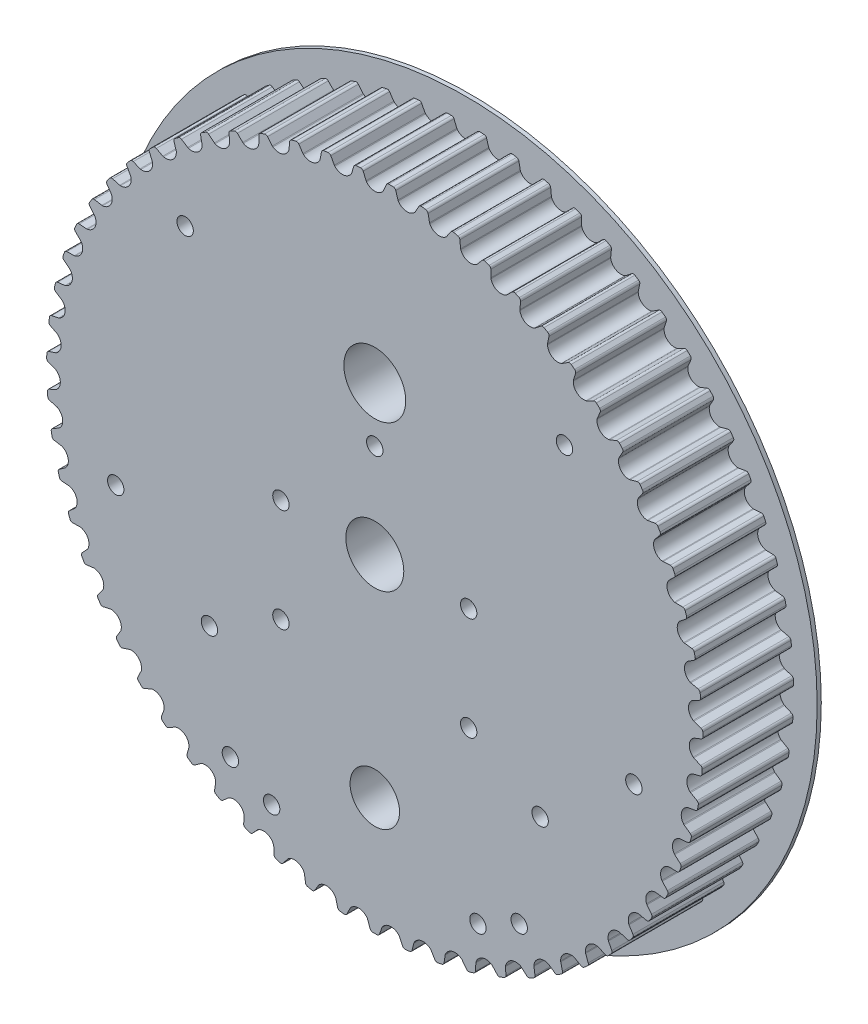
from build123d import *

# Parameters (mm, degrees)
BOSS_EXTRUDE1_DEPTH = 22
SKETCH2_R           = 85.214091318
BOSS_EXTRUDE2_DEPTH = 1
SKETCH3_R           = 7.025
SKETCH3_R_2         = 6
SKETCH3_R_3         = 7.5
CUT_EXTRUDE1_DEPTH  = 123.686114611
SKETCH4_R           = 1.985
CUT_EXTRUDE2_DEPTH  = 18


with BuildPart() as part:
    # Sketch1 → Boss-Extrude1 (new body)
    with BuildSketch(Plane.XY):
        with BuildLine():
            ThreePointArc((-2.00858237, 77.225966305), (-2.06415437, 77.308346172), (-2.108533634, 77.397257198))
            Line((-2.108533634, 77.397257198), (-2.806365183, 79.058376339))
            ThreePointArc((-2.806365183, 79.058376339), (-3.057533909, 79.355500397), (-3.433430091, 79.455852257))
            ThreePointArc((-3.433430091, 79.455852257), (-3.69885733, 79.443938437), (-3.964243287, 79.431137945))
            ThreePointArc((-3.964243287, 79.431137945), (-4.229584998, 79.417450921), (-4.494879503, 79.402877519))
            ThreePointArc((-4.494879503, 79.402877519), (-4.858915954, 79.265597157), (-5.079252563, 78.944941245))
            Line((-5.079252563, 78.944941245), (-5.608222375, 77.222594994))
            ThreePointArc((-5.608222375, 77.222594994), (-5.643528429, 77.129707039), (-5.690621893, 77.042203352))
            ThreePointArc((-5.690621893, 77.042203352), (-7.591122322, 75.861842835), (-9.687824439, 76.642222909))
            ThreePointArc((-9.687824439, 76.642222909), (-9.751322675, 76.718660228), (-9.804334089, 76.802710687))
            Line((-9.804334089, 76.802710687), (-10.664092012, 78.386093769))
            ThreePointArc((-10.664092012, 78.386093769), (-10.943596627, 78.656733022), (-11.327616714, 78.719159038))
            ThreePointArc((-11.327616714, 78.719159038), (-11.590538753, 78.680876402), (-11.853331429, 78.64171561))
            ThreePointArc((-11.853331429, 78.64171561), (-12.11599181, 78.601677097), (-12.378516965, 78.560761311))
            ThreePointArc((-12.378516965, 78.560761311), (-12.727075727, 78.3879168), (-12.914390416, 78.046915859))
            Line((-12.914390416, 78.046915859), (-13.26924135, 76.280459947))
            ThreePointArc((-13.26924135, 76.280459947), (-13.295123307, 76.184518226), (-13.333270199, 76.092760369))
            ThreePointArc((-13.333270199, 76.092760369), (-15.10680066, 74.729036594), (-17.270784557, 75.29677467))
            ThreePointArc((-17.270784557, 75.29677467), (-17.341577955, 75.366509771), (-17.402694666, 75.444864333))
            Line((-17.402694666, 75.444864333), (-18.415834303, 76.934774984))
            ThreePointArc((-18.415834303, 76.934774984), (-18.720896964, 77.176239697), (-19.109224393, 77.20011945))
            ThreePointArc((-19.109224393, 77.20011945), (-19.367028194, 77.135848468), (-19.624615838, 77.070716574))
            ThreePointArc((-19.624615838, 77.070716574), (-19.881984453, 77.004724493), (-20.139131164, 76.937872962))
            ThreePointArc((-20.139131164, 76.937872962), (-20.468748104, 76.73118211), (-20.621179254, 76.373225158))
            Line((-20.621179254, 76.373225158), (-20.798384643, 74.58021542))
            ThreePointArc((-20.798384643, 74.58021542), (-20.814585277, 74.482173443), (-20.843406476, 74.387073348))
            ThreePointArc((-20.843406476, 74.387073348), (-22.472340826, 72.853539614), (-24.682099858, 73.202993255))
            ThreePointArc((-24.682099858, 73.202993255), (-24.759484842, 73.265333081), (-24.828099445, 73.337213021))
            Line((-24.828099445, 73.337213021), (-25.984551758, 74.71884384))
            ThreePointArc((-25.984551758, 74.71884384), (-26.312140616, 74.928734228), (-26.700916015, 74.913830392))
            ThreePointArc((-26.700916015, 74.913830392), (-26.951039407, 74.824209818), (-27.200861999, 74.733754131))
            ThreePointArc((-27.200861999, 74.733754131), (-27.450381001, 74.642464341), (-27.69959363, 74.550341466))
            ThreePointArc((-27.69959363, 74.550341466), (-28.006992866, 74.311858458), (-28.123025549, 73.940503033))
            Line((-28.123025549, 73.940503033), (-28.120824246, 72.138759204))
            ThreePointArc((-28.120824246, 72.138759204), (-28.127182546, 72.039591358), (-28.146391615, 71.942094172))
            ThreePointArc((-28.146391615, 71.942094172), (-29.614540772, 70.253991426), (-31.848113362, 70.381687605))
            ThreePointArc((-31.848113362, 70.381687605), (-31.931320845, 70.436012594), (-32.006751418, 70.500703539))
            Line((-32.006751418, 70.500703539), (-33.295023065, 71.760323257))
            ThreePointArc((-33.295023065, 71.760323257), (-33.641882394, 71.936553336), (-34.027241938, 71.88301403))
            ThreePointArc((-34.027241938, 71.88301403), (-34.267199083, 71.768934554), (-34.506773772, 71.654054064))
            ThreePointArc((-34.506773772, 71.654054064), (-34.745963331, 71.538373844), (-34.98476509, 71.421895183))
            ThreePointArc((-34.98476509, 71.421895183), (-35.26689155, 71.153990171), (-35.345372581, 70.77292697))
            Line((-35.345372581, 70.77292697), (-35.163786463, 68.98035559))
            ThreePointArc((-35.163786463, 68.98035559), (-35.160239239, 68.881047449), (-35.169645269, 68.782122143))
            ThreePointArc((-35.169645269, 68.782122143), (-36.462418108, 66.956227509), (-38.697606007, 66.860897123))
            ThreePointArc((-38.697606007, 66.860897123), (-38.785809036, 66.90666737), (-38.867305915, 66.963526391))
            Line((-38.867305915, 66.963526391), (-40.274593474, 68.088616342))
            ThreePointArc((-40.274593474, 68.088616342), (-40.637276031, 68.229434657), (-41.015389843, 68.137791981))
            ThreePointArc((-41.015389843, 68.137791981), (-41.242795939, 68.000387375), (-41.469741725, 67.862223816))
            ThreePointArc((-41.469741725, 67.862223816), (-41.696224666, 67.723302847), (-41.922242237, 67.583626019))
            ThreePointArc((-41.922242237, 67.583626019), (-42.176292022, 67.288961563), (-42.21644142, 66.901977763))
            Line((-42.21644142, 66.901977763), (-41.857275173, 65.136394212))
            ThreePointArc((-41.857275173, 65.136394212), (-41.843857678, 65.037932745), (-41.843367187, 64.938562482))
            ThreePointArc((-41.843367187, 64.938562482), (-42.947915551, 62.993022521), (-45.162504458, 62.675613008))
            ThreePointArc((-45.162504458, 62.675613008), (-45.254826431, 62.712373626), (-45.341579664, 62.760835633))
            Line((-45.341579664, 62.760835633), (-46.853896879, 63.740214167))
            ThreePointArc((-46.853896879, 63.740214167), (-47.228798161, 63.844221204), (-47.595908377, 63.715385943))
            ThreePointArc((-47.595908377, 63.715385943), (-47.80850336, 63.556021795), (-48.020564753, 63.395948299))
            ThreePointArc((-48.020564753, 63.395948299), (-48.232090189, 63.235167241), (-48.443077306, 63.073680416))
            ThreePointArc((-48.443077306, 63.073680416), (-48.666525555, 62.755185023), (-48.667944298, 62.366126644))
            Line((-48.667944298, 62.366126644), (-48.134767477, 60.645078084))
            ThreePointArc((-48.134767477, 60.645078084), (-48.11161306, 60.548441845), (-48.101230924, 60.449614213))
            ThreePointArc((-48.101230924, 60.449614213), (-49.006577314, 58.403764575), (-51.17855765, 57.867430492))
            ThreePointArc((-51.17855765, 57.867430492), (-51.274081029, 57.894816138), (-51.365228424, 57.934399494))
            Line((-51.365228424, 57.934399494), (-52.967545206, 58.758333108))
            ThreePointArc((-52.967545206, 58.758333108), (-53.350939277, 58.824495197), (-53.70339739, 58.659747773))
            ThreePointArc((-53.70339739, 58.659747773), (-53.899068396, 58.480007918), (-54.094137835, 58.299615367))
            ThreePointArc((-54.094137835, 58.299615367), (-54.288603529, 58.118572134), (-54.482463308, 57.936880239))
            ThreePointArc((-54.482463308, 57.936880239), (-54.673089293, 57.597719261), (-54.635763281, 57.210452939))
            Line((-54.635763281, 57.210452939), (-53.933874836, 55.551043924))
            ThreePointArc((-53.933874836, 55.551043924), (-53.901213616, 55.457193328), (-53.881043017, 55.359890519))
            ThreePointArc((-53.881043017, 55.359890519), (-54.578189694, 53.234063777), (-56.685975343, 52.484135454))
            ThreePointArc((-56.685975343, 52.484135454), (-56.783750775, 52.501873957), (-56.878386467, 52.532185265))
            Line((-56.878386467, 52.532185265), (-58.554778273, 53.192485336))
            ThreePointArc((-58.554778273, 53.192485336), (-58.942854789, 53.220144929), (-59.277157912, 53.021122677))
            ThreePointArc((-59.277157912, 53.021122677), (-59.453960275, 52.822793448), (-59.630099072, 52.623874664))
            ThreePointArc((-59.630099072, 52.623874664), (-59.805572338, 52.424368545), (-59.980378113, 52.224277318))
            ThreePointArc((-59.980378113, 52.224277318), (-60.136287306, 51.867821488), (-60.060587502, 51.48619605))
            Line((-60.060587502, 51.48619605), (-59.196963116, 49.904918532))
            ThreePointArc((-59.196963116, 49.904918532), (-59.155119696, 49.814786308), (-59.125361097, 49.719975362))
            ThreePointArc((-59.125361097, 49.719975362), (-59.607379505, 47.535298937), (-61.630022345, 46.579229498))
            ThreePointArc((-61.630022345, 46.579229498), (-61.729078094, 46.587144566), (-61.826261552, 46.607882577))
            Line((-61.826261552, 46.607882577), (-63.560067646, 47.097986747))
            ThreePointArc((-63.560067646, 47.097986747), (-63.948969729, 47.08686895), (-64.261795408, 46.855549842))
            ThreePointArc((-64.261795408, 46.855549842), (-64.417971986, 46.640602325), (-64.573429595, 46.425134253))
            ThreePointArc((-64.573429595, 46.425134253), (-64.7281665, 46.209148029), (-64.882180973, 45.992646066))
            ThreePointArc((-64.882180973, 45.992646066), (-65.001823879, 45.622438002), (-64.888502621, 45.250246213))
            Line((-64.888502621, 45.250246213), (-63.871725381, 43.762815639))
            ThreePointArc((-63.871725381, 43.762815639), (-63.821115619, 43.677297561), (-63.782064776, 43.585920752))
            ThreePointArc((-63.782064776, 43.585920752), (-64.044164399, 41.36410694), (-65.961562497, 40.211398233))
            ThreePointArc((-65.961562497, 40.211398233), (-66.060914102, 40.209411201), (-66.159679472, 40.220369813))
            Line((-66.159679472, 40.220369813), (-67.933668512, 40.535407206))
            ThreePointArc((-67.933668512, 40.535407206), (-68.319531077, 40.485622513), (-68.60777031, 40.224305502))
            ThreePointArc((-68.60777031, 40.224305502), (-68.74176895, 39.994875943), (-68.875000363, 39.765))
            ThreePointArc((-68.875000363, 39.765), (-69.007463062, 39.53468024), (-69.139155569, 39.303919234))
            ThreePointArc((-69.139155569, 39.303919234), (-69.221343123, 38.923638231), (-69.071526649, 38.5645791))
            Line((-69.071526649, 38.5645791), (-67.911701744, 37.185778223))
            ThreePointArc((-67.911701744, 37.185778223), (-67.852828622, 37.105724209), (-67.80487364, 37.018689679))
            ThreePointArc((-67.80487364, 37.018689679), (-67.844449614, 34.781819864), (-69.637547006, 33.443928026))
            ThreePointArc((-69.637547006, 33.443928026), (-69.736207066, 33.432058643), (-69.835572775, 33.433128944))
            Line((-69.835572775, 33.433128944), (-71.632114059, 33.569968577))
            ThreePointArc((-71.632114059, 33.569968577), (-72.011102232, 33.48201177), (-72.271890367, 33.193293943))
            ThreePointArc((-72.271890367, 33.193293943), (-72.382379331, 32.951662514), (-72.492060434, 32.709663312))
            ThreePointArc((-72.492060434, 32.709663312), (-72.600932454, 32.467299037), (-72.708994175, 32.224572395))
            ThreePointArc((-72.708994175, 32.224572395), (-72.75290956, 31.837997856), (-72.568086813, 31.495639874))
            Line((-72.568086813, 31.495639874), (-71.276741104, 30.239171836))
            ThreePointArc((-71.276741104, 30.239171836), (-71.210189731, 30.165377498), (-71.153807206, 30.083550238))
            ThreePointArc((-71.153807206, 30.083550238), (-70.970466208, 27.853855436), (-72.621442287, 26.344077037))
            ThreePointArc((-72.621442287, 26.344077037), (-72.718430274, 26.322443267), (-72.81740878, 26.313614619))
            Line((-72.81740878, 26.313614619), (-74.618647475, 26.270896518))
            ThreePointArc((-74.618647475, 26.270896518), (-74.986994701, 26.145641752), (-75.217739908, 25.832392516))
            ThreePointArc((-75.217739908, 25.832392516), (-75.303621106, 25.58096066), (-75.388661841, 25.329243295))
            ThreePointArc((-75.388661841, 25.329243295), (-75.472861162, 25.07724323), (-75.556218131, 24.824963278))
            ThreePointArc((-75.556218131, 24.824963278), (-75.561424896, 24.435937154), (-75.343432728, 24.113682829))
            Line((-75.343432728, 24.113682829), (-73.933400189, 22.992034974))
            ThreePointArc((-73.933400189, 22.992034974), (-73.859831981, 22.925233714), (-73.79558227, 22.849426958))
            ThreePointArc((-73.79558227, 22.849426958), (-73.391146424, 20.64906688), (-74.883593049, 18.982406775))
            ThreePointArc((-74.883593049, 18.982406775), (-74.977945052, 18.951223623), (-75.075552662, 18.93258377))
            Line((-75.075552662, 18.93258377), (-76.863587248, 18.710732487))
            ThreePointArc((-76.863587248, 18.710732487), (-77.217632726, 18.5494246), (-77.416041757, 18.214757166))
            ThreePointArc((-77.416041757, 18.214757166), (-77.476461664, 17.956023725), (-77.536016856, 17.697089878))
            ThreePointArc((-77.536016856, 17.697089878), (-77.594706668, 17.437958512), (-77.652530446, 17.178632522))
            ThreePointArc((-77.652530446, 17.178632522), (-77.618976844, 16.791021131), (-77.369981759, 16.492073171))
            Line((-77.369981759, 16.492073171), (-75.855275927, 15.516392939))
            ThreePointArc((-75.855275927, 15.516392939), (-75.775422038, 15.457248658), (-75.703943683, 15.388215808))
            ThreePointArc((-75.703943683, 15.388215808), (-75.082432455, 13.239058619), (-76.401517019, 11.432080827))
            ThreePointArc((-76.401517019, 11.432080827), (-76.492295327, 11.391658204), (-76.587561973, 11.363392398))
            Line((-76.587561973, 11.363392398), (-78.344622159, 10.96461279))
            ThreePointArc((-78.344622159, 10.96461279), (-78.680847227, 10.768854933), (-78.844948203, 10.416095376))
            ThreePointArc((-78.844948203, 10.416095376), (-78.879306338, 10.15263176), (-78.912784101, 9.889054831))
            ThreePointArc((-78.912784101, 9.889054831), (-78.945381118, 9.625367529), (-78.977097026, 9.361572799))
            ThreePointArc((-78.977097026, 9.361572799), (-78.905116528, 8.979228396), (-78.627593151, 8.70655788))
            Line((-78.627593151, 8.70655788), (-77.023267853, 7.88654202))
            ThreePointArc((-77.023267853, 7.88654202), (-76.937921907, 7.83564252), (-76.859925292, 7.774069656))
            ThreePointArc((-76.859925292, 7.774069656), (-76.02751554, 5.697474646), (-77.160128389, 3.768137723))
            ThreePointArc((-77.160128389, 3.768137723), (-77.246430806, 3.718877369), (-77.338409685, 3.681266527))
            Line((-77.338409685, 3.681266527), (-79.047033017, 3.109521846))
            ThreePointArc((-79.047033017, 3.109521846), (-79.362096118, 2.881259547), (-79.49025813, 2.513913751))
            ThreePointArc((-79.49025813, 2.513913751), (-79.498213027, 2.248338379), (-79.505280645, 1.982737914))
            ThreePointArc((-79.505280645, 1.982737914), (-79.511460903, 1.717115319), (-79.516753735, 1.45147356))
            ThreePointArc((-79.516753735, 1.45147356), (-79.407061715, 1.078196055), (-79.103768198, 0.834512905))
            Line((-79.103768198, 0.834512905), (-77.425767939, 0.178311104))
            ThreePointArc((-77.425767939, 0.178311104), (-77.335778143, 0.136162246), (-77.252038432, 0.082661306))
            ThreePointArc((-77.252038432, 0.082661306), (-76.217003018, -1.90073339), (-77.151887737, -3.933254827))
            ThreePointArc((-77.151887737, -3.933254827), (-77.23285655, -3.990863341), (-77.320633535, -4.037445425))
            Line((-77.320633535, -4.037445425), (-78.963838947, -4.776472924))
            ThreePointArc((-78.963838947, -4.776472924), (-79.254608844, -5.034971091), (-79.34555816, -5.413252278))
            ThreePointArc((-79.34555816, -5.413252278), (-79.32703076, -5.678299998), (-79.30761799, -5.943284343))
            ThreePointArc((-79.30761799, -5.943284343), (-79.287320068, -6.208202354), (-79.26613722, -6.473051076))
            ThreePointArc((-79.26613722, -6.473051076), (-79.119823847, -6.833551883), (-78.793774457, -7.045825835))
            Line((-78.793774457, -7.045825835), (-77.058775958, -7.531691949))
            ThreePointArc((-77.058775958, -7.531691949), (-76.96503667, -7.564671269), (-76.876386108, -7.609568568))
            ThreePointArc((-76.876386108, -7.609568568), (-75.649011679, -9.480051083), (-76.376876962, -11.595556923))
            ThreePointArc((-76.376876962, -11.595556923), (-76.451707468, -11.660941057), (-76.534410191, -11.71603143))
            Line((-76.534410191, -11.71603143), (-78.09586677, -12.61499696))
            ThreePointArc((-78.09586677, -12.61499696), (-78.35945366, -12.901161924), (-78.412286386, -13.286618975))
            ThreePointArc((-78.412286386, -13.286618975), (-78.367460821, -13.54850488), (-78.321760597, -13.81023957))
            ThreePointArc((-78.321760597, -13.81023957), (-78.275186224, -14.071820124), (-78.227738222, -14.333243622))
            ThreePointArc((-78.227738222, -14.333243622), (-78.046257623, -14.677384912), (-77.700692786, -14.856139991))
            Line((-77.700692786, -14.856139991), (-75.925939242, -15.166841663))
            ThreePointArc((-75.925939242, -15.166841663), (-75.829382086, -15.190323683), (-75.736701721, -15.226171131))
            ThreePointArc((-75.736701721, -15.226171131), (-74.329186474, -16.965151769), (-74.842798471, -19.142617164))
            ThreePointArc((-74.842798471, -19.142617164), (-74.910746969, -19.215127103), (-74.987553495, -19.278178251))
            Line((-74.987553495, -19.278178251), (-76.451742783, -20.328147489))
            ThreePointArc((-76.451742783, -20.328147489), (-76.685527021, -20.639135214), (-76.699718081, -21.027937283))
            ThreePointArc((-76.699718081, -21.027937283), (-76.629039849, -21.284058633), (-76.55750636, -21.539942431))
            ThreePointArc((-76.55750636, -21.539942431), (-76.485118413, -21.795585823), (-76.411876815, -22.050985954))
            ThreePointArc((-76.411876815, -22.050985954), (-76.197032628, -22.375347496), (-75.835386721, -22.518807154))
            Line((-75.835386721, -22.518807154), (-74.03851643, -22.651256491))
            ThreePointArc((-74.03851643, -22.651256491), (-73.940101034, -22.665007835), (-73.844311965, -22.691449165))
            ThreePointArc((-73.844311965, -22.691449165), (-72.270644421, -24.281645156), (-72.564898624, -26.499429476))
            ThreePointArc((-72.564898624, -26.499429476), (-72.625289812, -26.578344583), (-72.695436802, -26.648729876))
            Line((-72.695436802, -26.648729876), (-74.047807028, -27.839267755))
            ThreePointArc((-74.047807028, -27.839267755), (-74.249465162, -28.171987505), (-74.224873518, -28.560270502))
            ThreePointArc((-74.224873518, -28.560270502), (-74.129045051, -28.808081849), (-74.03238923, -29.055571668))
            ThreePointArc((-74.03238923, -29.055571668), (-73.934907133, -29.302737198), (-73.836599848, -29.54957568))
            ThreePointArc((-73.836599848, -29.54957568), (-73.590527289, -29.850933824), (-73.216394513, -29.957672294))
            Line((-73.216394513, -29.957672294), (-71.415265579, -29.910552956))
            ThreePointArc((-71.415265579, -29.910552956), (-71.315970039, -29.914436957), (-71.218024262, -29.931209383))
            ThreePointArc((-71.218024262, -29.931209383), (-69.493844234, -31.356816644), (-69.565816213, -33.592878553))
            ThreePointArc((-69.565816213, -33.592878553), (-69.618049897, -33.677414533), (-69.680840198, -33.754434451))
            Line((-69.680840198, -33.754434451), (-70.9079509, -35.073708871))
            ThreePointArc((-70.9079509, -35.073708871), (-71.075478761, -35.424853928), (-71.012348816, -35.808758923))
            ThreePointArc((-71.012348816, -35.808758923), (-70.8923225, -36.045797405), (-70.771504955, -36.282433579))
            ThreePointArc((-70.771504955, -36.282433579), (-70.649897529, -36.518664806), (-70.527501579, -36.754488447))
            ThreePointArc((-70.527501579, -36.754488447), (-70.252646228, -37.02984816), (-69.869744883, -37.098804628))
            Line((-69.869744883, -37.098804628), (-68.082257733, -36.872584907))
            ThreePointArc((-68.082257733, -36.872584907), (-67.983068894, -36.866562964), (-67.883939837, -36.873499794))
            ThreePointArc((-67.883939837, -36.873499794), (-66.026383002, -38.12035), (-65.875357467, -40.35246651))
            ThreePointArc((-65.875357467, -40.35246651), (-65.918914524, -40.441783207), (-65.973724099, -40.524672291))
            Line((-65.973724099, -40.524672291), (-67.0633797, -41.95957171))
            ThreePointArc((-67.0633797, -41.95957171), (-67.195112319, -42.325652237), (-67.094071488, -42.701363809))
            ThreePointArc((-67.094071488, -42.701363809), (-66.951040198, -42.925273632), (-66.807261668, -43.148704365))
            ThreePointArc((-66.807261668, -43.148704365), (-66.662737502, -43.371653516), (-66.517469313, -43.594118596))
            ThreePointArc((-66.517469313, -43.594118596), (-66.216562807, -43.840743229), (-65.828698337, -43.871232375))
            Line((-65.828698337, -43.871232375), (-64.072617824, -43.468160543))
            ThreePointArc((-64.072617824, -43.468160543), (-63.974521468, -43.452292506), (-63.87519432, -43.449324799))
            ThreePointArc((-63.87519432, -43.449324799), (-61.902721912, -44.505026192), (-61.530199822, -46.711013526))
            ThreePointArc((-61.530199822, -46.711013526), (-61.564647364, -46.804223271), (-61.61093149, -46.892157731))
            Line((-61.61093149, -46.892157731), (-62.552302502, -48.428421475))
            ThreePointArc((-62.552302502, -48.428421475), (-62.646930663, -48.805799198), (-62.508983134, -49.169583358))
            ThreePointArc((-62.508983134, -49.169583358), (-62.34436838, -49.378139204), (-62.179057801, -49.586143942))
            ThreePointArc((-62.179057801, -49.586143942), (-62.013053241, -49.793595248), (-61.846356553, -50.000490808))
            ThreePointArc((-61.846356553, -50.000490808), (-61.522389436, -50.215929295), (-61.133416613, -50.207648104))
            Line((-61.133416613, -50.207648104), (-59.426195452, -49.631730072))
            ThreePointArc((-59.426195452, -49.631730072), (-59.330166505, -49.606173643), (-59.231628424, -49.593330893))
            ThreePointArc((-59.231628424, -49.593330893), (-57.163843761, -50.447391438), (-56.573527408, -52.605325504))
            ThreePointArc((-56.573527408, -52.605325504), (-56.598523079, -52.701501936), (-56.635821764, -52.793607841))
            Line((-56.635821764, -52.793607841), (-57.419552419, -54.41596783))
            ThreePointArc((-57.419552419, -54.41596783), (-57.476135664, -54.800892201), (-57.302652422, -55.149133496))
            ThreePointArc((-57.302652422, -55.149133496), (-57.118090219, -55.340262646), (-56.932890522, -55.530774142))
            ThreePointArc((-56.932890522, -55.530774142), (-56.747055396, -55.72066586), (-56.560586916, -55.90993568))
            ThreePointArc((-56.560586916, -55.90993568), (-56.216778918, -56.092046896), (-55.830563529, -56.045077669))
            Line((-55.830563529, -56.045077669), (-54.189168851, -55.302037168))
            ThreePointArc((-54.189168851, -55.302037168), (-54.096161693, -55.26704634), (-53.999391995, -55.244456184))
            ThreePointArc((-53.999391995, -55.244456184), (-51.856845649, -55.888387845), (-51.054601862, -57.976822123))
            ThreePointArc((-51.054601862, -57.976822123), (-51.069897244, -58.075009398), (-51.097839797, -58.170371358))
            Line((-51.097839797, -58.170371358), (-51.716141027, -59.862703849))
            ThreePointArc((-51.716141027, -59.862703849), (-51.734117007, -60.251349316), (-51.526822206, -60.580586769))
            ThreePointArc((-51.526822206, -60.580586769), (-51.324146817, -60.752389694), (-51.120898598, -60.923514561))
            ThreePointArc((-51.120898598, -60.923514561), (-50.91707982, -61.093959461), (-50.712692755, -61.263722491))
            ThreePointArc((-50.712692755, -61.263722491), (-50.352460794, -61.410696534), (-49.972841221, -61.325506073))
            Line((-49.972841221, -61.325506073), (-48.413585945, -60.422727774))
            ThreePointArc((-48.413585945, -60.422727774), (-48.324524922, -60.378650301), (-48.230485347, -60.34653725))
            ThreePointArc((-48.230485347, -60.34653725), (-46.034470906, -60.773940343), (-45.028272746, -62.772119037))
            ThreePointArc((-45.028272746, -62.772119037), (-45.033715825, -62.871341325), (-45.05202454, -62.96901159))
            Line((-45.05202454, -62.96901159), (-45.498751392, -64.714497422))
            ThreePointArc((-45.498751392, -64.714497422), (-45.477941452, -65.103001453), (-45.238895282, -65.409962954))
            ThreePointArc((-45.238895282, -65.409962954), (-45.020120985, -65.560732199), (-44.800844218, -65.710769721))
            ThreePointArc((-44.800844218, -65.710769721), (-44.581067429, -65.860073845), (-44.36079307, -66.008642905))
            ThreePointArc((-44.36079307, -66.008642905), (-43.987717294, -66.11901908), (-43.618466366, -65.996454046))
            Line((-43.618466366, -65.996454046), (-42.156847072, -64.942910166))
            ThreePointArc((-42.156847072, -64.942910166), (-42.072617311, -64.890184109), (-41.982242468, -64.848867317))
            ThreePointArc((-41.982242468, -64.848867317), (-39.75458491, -65.055494119), (-38.554432425, -66.94355843))
            ThreePointArc((-38.554432425, -66.94355843), (-38.549969107, -67.042829616), (-38.558462024, -67.141837494))
            Line((-38.558462024, -67.141837494), (-38.829174724, -68.923129246))
            ThreePointArc((-38.829174724, -68.923129246), (-38.769785684, -69.307630712), (-38.501363892, -69.589265541))
            ThreePointArc((-38.501363892, -69.589265541), (-38.268664964, -69.717502694), (-38.03553892, -69.84496173))
            ThreePointArc((-38.03553892, -69.84496173), (-37.801988361, -69.971641227), (-37.568015894, -70.09753977))
            ThreePointArc((-37.568015894, -70.09753977), (-37.185804097, -70.170221109), (-36.830591596, -70.011499609))
            Line((-36.830591596, -70.011499609), (-35.481134512, -68.817660739))
            ThreePointArc((-35.481134512, -68.817660739), (-35.402573128, -68.756810114), (-35.316761201, -68.706700205))
            ThreePointArc((-35.316761201, -68.706700205), (-33.079599989, -68.690497167), (-31.697420833, -70.449682663))
            ThreePointArc((-31.697420833, -70.449682663), (-31.683095476, -70.548016146), (-31.681688189, -70.647377653))
            Line((-31.681688189, -70.647377653), (-31.773696272, -72.446772047))
            ThreePointArc((-31.773696272, -72.446772047), (-31.676318367, -72.8234496), (-31.38118865, -73.076958742))
            ThreePointArc((-31.38118865, -73.076958742), (-31.136877758, -73.181389325), (-30.892219348, -73.28500313))
            ThreePointArc((-30.892219348, -73.28500313), (-30.647216149, -73.387799002), (-30.401870897, -73.489775792))
            ThreePointArc((-30.401870897, -73.489775792), (-30.014321672, -73.524039956), (-29.67667786, -73.330739435))
            Line((-29.67667786, -73.330739435), (-28.452794497, -72.008470482))
            ThreePointArc((-28.452794497, -72.008470482), (-28.380682267, -71.940100049), (-28.300286095, -71.88169504))
            ThreePointArc((-28.300286095, -71.88169504), (-26.075855141, -71.642823194), (-24.525386033, -73.2556463))
            ThreePointArc((-24.525386033, -73.2556463), (-24.501341009, -73.352064796), (-24.490047503, -73.450792433))
            Line((-24.490047503, -73.450792433), (-24.402436553, -75.250406279))
            ThreePointArc((-24.402436553, -75.250406279), (-24.268037567, -75.615516328), (-23.949133056, -75.838380296))
            ThreePointArc((-23.949133056, -75.838380296), (-23.695638272, -75.91796643), (-23.441879021, -75.996705244))
            ThreePointArc((-23.441879021, -75.996705244), (-23.187858135, -76.074595859), (-22.933578449, -76.151637405))
            ThreePointArc((-22.933578449, -76.151637405), (-22.544543434, -76.147143861), (-22.227823967, -75.921185426))
            Line((-22.227823967, -75.921185426), (-21.141677827, -74.483627694))
            ThreePointArc((-21.141677827, -74.483627694), (-21.076731436, -74.40841695), (-21.002550032, -74.342297294))
            ThreePointArc((-21.002550032, -74.342297294), (-18.81295673, -73.883130656), (-17.109606927, -75.333562412))
            ThreePointArc((-17.109606927, -75.333562412), (-17.076081206, -75.427107672), (-17.055013722, -75.524220239))
            Line((-17.055013722, -75.524220239), (-16.788654455, -77.306168165))
            ThreePointArc((-16.788654455, -77.306168165), (-16.618570107, -77.656082083), (-16.279060219, -77.846085954))
            ThreePointArc((-16.279060219, -77.846085954), (-16.018900887, -77.900036678), (-15.758562769, -77.953117959))
            ThreePointArc((-15.758562769, -77.953117959), (-15.498048769, -78.005329205), (-15.237361795, -78.056669834))
            ThreePointArc((-15.237361795, -78.056669834), (-14.850707394, -78.01346324), (-14.558059972, -77.757092568))
            Line((-14.558059972, -77.757092568), (-13.620445664, -76.218533151))
            ThreePointArc((-13.620445664, -76.218533151), (-13.563310579, -76.137229574), (-13.49608119, -76.064052399))
            ThreePointArc((-13.49608119, -76.064052399), (-11.363086703, -75.389154373), (-9.523784861, -76.662779735))
            ThreePointArc((-9.523784861, -76.662779735), (-9.481111637, -76.752522064), (-9.450479553, -76.847054413))
            Line((-9.450479553, -76.847054413), (-9.008019167, -78.593626622))
            ThreePointArc((-9.008019167, -78.593626622), (-8.803939831, -78.924866806), (-8.447198768, -79.080122237))
            ThreePointArc((-8.447198768, -79.080122237), (-8.182960469, -79.107901362), (-7.91863084, -79.134797565))
            ThreePointArc((-7.91863084, -79.134797565), (-7.654212831, -79.160810544), (-7.389709393, -79.185940009))
            ThreePointArc((-7.389709393, -79.185940009), (-7.009278353, -79.104449773), (-6.743611438, -78.82021479))
            Line((-6.743611438, -78.82021479), (-5.963847394, -77.195944583))
            ThreePointArc((-5.963847394, -77.195944583), (-5.915091447, -77.109356204), (-5.85548223, -77.029848778))
            ThreePointArc((-5.85548223, -77.029848778), (-3.800285215, -76.145926804), (-1.843311143, -77.230087912))
            ThreePointArc((-1.843311143, -77.230087912), (-1.791914521, -77.31513541), (-1.752022272, -77.406148036))
            Line((-1.752022272, -77.406148036), (-1.137858137, -79.099986307))
            ThreePointArc((-1.137858137, -79.099986307), (-0.901812046, -79.409260744), (-0.53138526, -79.528224736))
            ThreePointArc((-0.53138526, -79.528224736), (-0.265694113, -79.529556183), (0, -79.53))
            ThreePointArc((0, -79.53), (0.265694113, -79.529556183), (0.53138526, -79.528224736))
            ThreePointArc((0.53138526, -79.528224736), (0.901812046, -79.409260744), (1.137858137, -79.099986307))
            Line((1.137858137, -79.099986307), (1.752022272, -77.406148036))
            ThreePointArc((1.752022272, -77.406148036), (1.791914521, -77.31513541), (1.843311143, -77.230087912))
            ThreePointArc((1.843311143, -77.230087912), (3.800285215, -76.145926804), (5.85548223, -77.029848778))
            ThreePointArc((5.85548223, -77.029848778), (5.915091447, -77.109356204), (5.963847394, -77.195944583))
            Line((5.963847394, -77.195944583), (6.743611438, -78.82021479))
            ThreePointArc((6.743611438, -78.82021479), (7.009278353, -79.104449773), (7.389709393, -79.185940009))
            ThreePointArc((7.389709393, -79.185940009), (7.654212831, -79.160810544), (7.91863084, -79.134797565))
            ThreePointArc((7.91863084, -79.134797565), (8.182960469, -79.107901362), (8.447198768, -79.080122237))
            ThreePointArc((8.447198768, -79.080122237), (8.803939831, -78.924866806), (9.008019167, -78.593626622))
            Line((9.008019167, -78.593626622), (9.450479553, -76.847054413))
            ThreePointArc((9.450479553, -76.847054413), (9.481111637, -76.752522064), (9.523784861, -76.662779735))
            ThreePointArc((9.523784861, -76.662779735), (11.363086703, -75.389154373), (13.49608119, -76.064052399))
            ThreePointArc((13.49608119, -76.064052399), (13.563310579, -76.137229574), (13.620445664, -76.218533151))
            Line((13.620445664, -76.218533151), (14.558059972, -77.757092568))
            ThreePointArc((14.558059972, -77.757092568), (14.850707394, -78.01346324), (15.237361795, -78.056669834))
            ThreePointArc((15.237361795, -78.056669834), (15.498048769, -78.005329205), (15.758562769, -77.953117959))
            ThreePointArc((15.758562769, -77.953117959), (16.018900887, -77.900036678), (16.279060219, -77.846085954))
            ThreePointArc((16.279060219, -77.846085954), (16.618570107, -77.656082083), (16.788654455, -77.306168165))
            Line((16.788654455, -77.306168165), (17.055013722, -75.524220239))
            ThreePointArc((17.055013722, -75.524220239), (17.076081206, -75.427107672), (17.109606927, -75.333562412))
            ThreePointArc((17.109606927, -75.333562412), (18.81295673, -73.883130656), (21.002550032, -74.342297294))
            ThreePointArc((21.002550032, -74.342297294), (21.076731436, -74.40841695), (21.141677827, -74.483627694))
            Line((21.141677827, -74.483627694), (22.227823967, -75.921185426))
            ThreePointArc((22.227823967, -75.921185426), (22.544543434, -76.147143861), (22.933578449, -76.151637405))
            ThreePointArc((22.933578449, -76.151637405), (23.187858135, -76.074595859), (23.441879021, -75.996705244))
            ThreePointArc((23.441879021, -75.996705244), (23.695638272, -75.91796643), (23.949133056, -75.838380295))
            ThreePointArc((23.949133056, -75.838380295), (24.268037567, -75.615516328), (24.402436553, -75.250406279))
            Line((24.402436553, -75.250406279), (24.490047503, -73.450792433))
            ThreePointArc((24.490047503, -73.450792433), (24.501341009, -73.352064796), (24.525386033, -73.2556463))
            ThreePointArc((24.525386033, -73.2556463), (26.075855141, -71.642823194), (28.300286095, -71.88169504))
            ThreePointArc((28.300286095, -71.88169504), (28.380682267, -71.940100049), (28.452794497, -72.008470482))
            Line((28.452794497, -72.008470482), (29.67667786, -73.330739435))
            ThreePointArc((29.67667786, -73.330739435), (30.014321672, -73.524039956), (30.401870897, -73.489775792))
            ThreePointArc((30.401870897, -73.489775792), (30.647216149, -73.387799002), (30.892219348, -73.28500313))
            ThreePointArc((30.892219348, -73.28500313), (31.136877758, -73.181389325), (31.38118865, -73.076958742))
            ThreePointArc((31.38118865, -73.076958742), (31.676318367, -72.8234496), (31.773696272, -72.446772047))
            Line((31.773696272, -72.446772047), (31.681688189, -70.647377653))
            ThreePointArc((31.681688189, -70.647377653), (31.683095476, -70.548016146), (31.697420833, -70.449682663))
            ThreePointArc((31.697420833, -70.449682663), (33.079599989, -68.690497167), (35.316761201, -68.706700205))
            ThreePointArc((35.316761201, -68.706700205), (35.402573128, -68.756810114), (35.481134512, -68.817660739))
            Line((35.481134512, -68.817660739), (36.830591596, -70.011499609))
            ThreePointArc((36.830591596, -70.011499609), (37.185804097, -70.170221109), (37.568015894, -70.09753977))
            ThreePointArc((37.568015894, -70.09753977), (37.801988361, -69.971641227), (38.03553892, -69.84496173))
            ThreePointArc((38.03553892, -69.84496173), (38.268664964, -69.717502694), (38.501363892, -69.589265541))
            ThreePointArc((38.501363892, -69.589265541), (38.769785684, -69.307630712), (38.829174724, -68.923129246))
            Line((38.829174724, -68.923129246), (38.558462024, -67.141837494))
            ThreePointArc((38.558462024, -67.141837494), (38.549969107, -67.042829616), (38.554432425, -66.94355843))
            ThreePointArc((38.554432425, -66.94355843), (39.75458491, -65.055494119), (41.982242468, -64.848867317))
            ThreePointArc((41.982242468, -64.848867317), (42.072617311, -64.890184109), (42.156847072, -64.942910166))
            Line((42.156847072, -64.942910166), (43.618466366, -65.996454046))
            ThreePointArc((43.618466366, -65.996454046), (43.987717294, -66.11901908), (44.36079307, -66.008642905))
            ThreePointArc((44.36079307, -66.008642905), (44.581067429, -65.860073845), (44.800844218, -65.710769721))
            ThreePointArc((44.800844218, -65.710769721), (45.020120985, -65.560732199), (45.238895282, -65.409962954))
            ThreePointArc((45.238895282, -65.409962954), (45.477941452, -65.103001453), (45.498751392, -64.714497422))
            Line((45.498751392, -64.714497422), (45.052024541, -62.96901159))
            ThreePointArc((45.052024541, -62.96901159), (45.033715825, -62.871341325), (45.028272746, -62.772119037))
            ThreePointArc((45.028272746, -62.772119037), (46.034470906, -60.773940343), (48.230485347, -60.34653725))
            ThreePointArc((48.230485347, -60.34653725), (48.324524922, -60.378650301), (48.413585945, -60.422727774))
            Line((48.413585945, -60.422727774), (49.972841221, -61.325506073))
            ThreePointArc((49.972841221, -61.325506073), (50.352460794, -61.410696534), (50.712692755, -61.263722491))
            ThreePointArc((50.712692755, -61.263722491), (50.91707982, -61.093959461), (51.120898598, -60.923514561))
            ThreePointArc((51.120898598, -60.923514561), (51.324146817, -60.752389694), (51.526822206, -60.580586769))
            ThreePointArc((51.526822206, -60.580586769), (51.734117007, -60.251349316), (51.716141027, -59.862703849))
            Line((51.716141027, -59.862703849), (51.097839797, -58.170371358))
            ThreePointArc((51.097839797, -58.170371358), (51.069897244, -58.075009398), (51.054601863, -57.976822123))
            ThreePointArc((51.054601863, -57.976822123), (51.856845649, -55.888387845), (53.999391995, -55.244456184))
            ThreePointArc((53.999391995, -55.244456184), (54.096161693, -55.26704634), (54.189168851, -55.302037168))
            Line((54.189168851, -55.302037168), (55.830563529, -56.045077669))
            ThreePointArc((55.830563529, -56.045077669), (56.216778918, -56.092046896), (56.560586916, -55.90993568))
            ThreePointArc((56.560586916, -55.90993568), (56.747055396, -55.72066586), (56.932890522, -55.530774142))
            ThreePointArc((56.932890522, -55.530774142), (57.118090219, -55.340262646), (57.302652422, -55.149133496))
            ThreePointArc((57.302652422, -55.149133496), (57.476135664, -54.800892201), (57.419552419, -54.41596783))
            Line((57.419552419, -54.41596783), (56.635821764, -52.793607841))
            ThreePointArc((56.635821764, -52.793607841), (56.598523079, -52.701501936), (56.573527409, -52.605325504))
            ThreePointArc((56.573527409, -52.605325504), (57.163843761, -50.447391438), (59.231628424, -49.593330893))
            ThreePointArc((59.231628424, -49.593330893), (59.330166505, -49.606173643), (59.426195452, -49.631730072))
            Line((59.426195452, -49.631730072), (61.133416613, -50.207648104))
            ThreePointArc((61.133416613, -50.207648104), (61.522389436, -50.215929295), (61.846356553, -50.000490808))
            ThreePointArc((61.846356553, -50.000490808), (62.013053241, -49.793595248), (62.179057801, -49.586143942))
            ThreePointArc((62.179057801, -49.586143942), (62.34436838, -49.378139204), (62.508983134, -49.169583358))
            ThreePointArc((62.508983134, -49.169583358), (62.646930663, -48.805799198), (62.552302502, -48.428421475))
            Line((62.552302502, -48.428421475), (61.61093149, -46.892157731))
            ThreePointArc((61.61093149, -46.892157731), (61.564647364, -46.804223271), (61.530199822, -46.711013526))
            ThreePointArc((61.530199822, -46.711013526), (61.902721912, -44.505026192), (63.87519432, -43.449324799))
            ThreePointArc((63.87519432, -43.449324799), (63.974521468, -43.452292506), (64.072617824, -43.468160543))
            Line((64.072617824, -43.468160543), (65.828698337, -43.871232375))
            ThreePointArc((65.828698337, -43.871232375), (66.216562807, -43.840743229), (66.517469313, -43.594118596))
            ThreePointArc((66.517469313, -43.594118596), (66.662737502, -43.371653516), (66.807261668, -43.148704365))
            ThreePointArc((66.807261668, -43.148704365), (66.951040198, -42.925273632), (67.094071488, -42.701363809))
            ThreePointArc((67.094071488, -42.701363809), (67.195112319, -42.325652237), (67.0633797, -41.95957171))
            Line((67.0633797, -41.95957171), (65.973724099, -40.524672291))
            ThreePointArc((65.973724099, -40.524672291), (65.918914524, -40.441783207), (65.875357467, -40.35246651))
            ThreePointArc((65.875357467, -40.35246651), (66.026383002, -38.12035), (67.883939837, -36.873499794))
            ThreePointArc((67.883939837, -36.873499794), (67.983068894, -36.866562964), (68.082257733, -36.872584907))
            Line((68.082257733, -36.872584907), (69.869744883, -37.098804628))
            ThreePointArc((69.869744883, -37.098804628), (70.252646228, -37.02984816), (70.527501579, -36.754488447))
            ThreePointArc((70.527501579, -36.754488447), (70.649897529, -36.518664806), (70.771504955, -36.282433579))
            ThreePointArc((70.771504955, -36.282433579), (70.8923225, -36.045797405), (71.012348816, -35.808758923))
            ThreePointArc((71.012348816, -35.808758923), (71.075478761, -35.424853928), (70.9079509, -35.073708871))
            Line((70.9079509, -35.073708871), (69.680840198, -33.75443445))
            ThreePointArc((69.680840198, -33.75443445), (69.618049897, -33.677414533), (69.565816213, -33.592878553))
            ThreePointArc((69.565816213, -33.592878553), (69.493844234, -31.356816644), (71.218024262, -29.931209383))
            ThreePointArc((71.218024262, -29.931209383), (71.315970039, -29.914436957), (71.415265579, -29.910552956))
            Line((71.415265579, -29.910552956), (73.216394513, -29.957672294))
            ThreePointArc((73.216394513, -29.957672294), (73.590527289, -29.850933824), (73.836599848, -29.54957568))
            ThreePointArc((73.836599848, -29.54957568), (73.934907133, -29.302737198), (74.03238923, -29.055571668))
            ThreePointArc((74.03238923, -29.055571668), (74.129045051, -28.808081849), (74.224873518, -28.560270502))
            ThreePointArc((74.224873518, -28.560270502), (74.249465162, -28.171987505), (74.047807028, -27.839267755))
            Line((74.047807028, -27.839267755), (72.695436802, -26.648729876))
            ThreePointArc((72.695436802, -26.648729876), (72.625289812, -26.578344583), (72.564898624, -26.499429476))
            ThreePointArc((72.564898624, -26.499429476), (72.270644421, -24.281645156), (73.844311965, -22.691449165))
            ThreePointArc((73.844311965, -22.691449165), (73.940101034, -22.665007835), (74.03851643, -22.651256491))
            Line((74.03851643, -22.651256491), (75.835386721, -22.518807154))
            ThreePointArc((75.835386721, -22.518807154), (76.197032628, -22.375347496), (76.411876816, -22.050985954))
            ThreePointArc((76.411876816, -22.050985954), (76.485118413, -21.795585823), (76.55750636, -21.539942431))
            ThreePointArc((76.55750636, -21.539942431), (76.629039849, -21.284058633), (76.699718081, -21.027937283))
            ThreePointArc((76.699718081, -21.027937283), (76.685527021, -20.639135214), (76.451742783, -20.328147489))
            Line((76.451742783, -20.328147489), (74.987553495, -19.278178251))
            ThreePointArc((74.987553495, -19.278178251), (74.910746969, -19.215127103), (74.842798471, -19.142617164))
            ThreePointArc((74.842798471, -19.142617164), (74.329186474, -16.965151769), (75.736701721, -15.226171131))
            ThreePointArc((75.736701721, -15.226171131), (75.829382086, -15.190323683), (75.925939242, -15.166841663))
            Line((75.925939242, -15.166841663), (77.700692786, -14.856139991))
            ThreePointArc((77.700692786, -14.856139991), (78.046257623, -14.677384912), (78.227738222, -14.333243622))
            ThreePointArc((78.227738222, -14.333243622), (78.275186224, -14.071820124), (78.321760597, -13.81023957))
            ThreePointArc((78.321760597, -13.81023957), (78.367460821, -13.54850488), (78.412286386, -13.286618975))
            ThreePointArc((78.412286386, -13.286618975), (78.35945366, -12.901161924), (78.09586677, -12.61499696))
            Line((78.09586677, -12.61499696), (76.534410191, -11.71603143))
            ThreePointArc((76.534410191, -11.71603143), (76.451707468, -11.660941057), (76.376876962, -11.595556923))
            ThreePointArc((76.376876962, -11.595556923), (75.649011679, -9.480051083), (76.876386108, -7.609568568))
            ThreePointArc((76.876386108, -7.609568568), (76.96503667, -7.564671269), (77.058775958, -7.531691949))
            Line((77.058775958, -7.531691949), (78.793774457, -7.045825835))
            ThreePointArc((78.793774457, -7.045825835), (79.119823847, -6.833551883), (79.26613722, -6.473051076))
            ThreePointArc((79.26613722, -6.473051076), (79.287320068, -6.208202354), (79.30761799, -5.943284343))
            ThreePointArc((79.30761799, -5.943284343), (79.32703076, -5.678299998), (79.34555816, -5.413252278))
            ThreePointArc((79.34555816, -5.413252278), (79.254608844, -5.034971091), (78.963838947, -4.776472924))
            Line((78.963838947, -4.776472924), (77.320633535, -4.037445425))
            ThreePointArc((77.320633535, -4.037445425), (77.23285655, -3.990863341), (77.151887737, -3.933254827))
            ThreePointArc((77.151887737, -3.933254827), (76.217003018, -1.90073339), (77.252038432, 0.082661306))
            ThreePointArc((77.252038432, 0.082661306), (77.335778143, 0.136162246), (77.425767939, 0.178311104))
            Line((77.425767939, 0.178311104), (79.103768198, 0.834512905))
            ThreePointArc((79.103768198, 0.834512905), (79.407061715, 1.078196055), (79.516753735, 1.45147356))
            ThreePointArc((79.516753735, 1.45147356), (79.511460903, 1.717115319), (79.505280645, 1.982737914))
            ThreePointArc((79.505280645, 1.982737914), (79.498213027, 2.248338379), (79.49025813, 2.513913751))
            ThreePointArc((79.49025813, 2.513913751), (79.362096118, 2.881259547), (79.047033017, 3.109521846))
            Line((79.047033017, 3.109521846), (77.338409685, 3.681266527))
            ThreePointArc((77.338409685, 3.681266527), (77.246430806, 3.718877369), (77.160128389, 3.768137723))
            ThreePointArc((77.160128389, 3.768137723), (76.02751554, 5.697474646), (76.859925292, 7.774069656))
            ThreePointArc((76.859925292, 7.774069656), (76.937921907, 7.83564252), (77.023267853, 7.88654202))
            Line((77.023267853, 7.88654202), (78.627593151, 8.70655788))
            ThreePointArc((78.627593151, 8.70655788), (78.905116528, 8.979228396), (78.977097026, 9.361572799))
            ThreePointArc((78.977097026, 9.361572799), (78.945381118, 9.625367529), (78.912784101, 9.889054831))
            ThreePointArc((78.912784101, 9.889054831), (78.879306338, 10.15263176), (78.844948203, 10.416095376))
            ThreePointArc((78.844948203, 10.416095376), (78.680847227, 10.768854933), (78.344622159, 10.96461279))
            Line((78.344622159, 10.96461279), (76.587561973, 11.363392398))
            ThreePointArc((76.587561973, 11.363392398), (76.492295327, 11.391658204), (76.401517019, 11.432080827))
            ThreePointArc((76.401517019, 11.432080827), (75.082432455, 13.239058619), (75.703943683, 15.388215808))
            ThreePointArc((75.703943683, 15.388215808), (75.775422038, 15.457248658), (75.855275927, 15.516392939))
            Line((75.855275927, 15.516392939), (77.369981759, 16.492073171))
            ThreePointArc((77.369981759, 16.492073171), (77.618976844, 16.791021131), (77.652530446, 17.178632522))
            ThreePointArc((77.652530446, 17.178632522), (77.594706668, 17.437958512), (77.536016856, 17.697089878))
            ThreePointArc((77.536016856, 17.697089878), (77.476461664, 17.956023725), (77.416041757, 18.214757166))
            ThreePointArc((77.416041757, 18.214757166), (77.217632726, 18.5494246), (76.863587248, 18.710732487))
            Line((76.863587248, 18.710732487), (75.075552662, 18.93258377))
            ThreePointArc((75.075552662, 18.93258377), (74.977945052, 18.951223623), (74.883593049, 18.982406775))
            ThreePointArc((74.883593049, 18.982406775), (73.391146424, 20.64906688), (73.79558227, 22.849426958))
            ThreePointArc((73.79558227, 22.849426958), (73.859831981, 22.925233714), (73.933400189, 22.992034974))
            Line((73.933400189, 22.992034974), (75.343432728, 24.113682829))
            ThreePointArc((75.343432728, 24.113682829), (75.561424896, 24.435937154), (75.556218131, 24.824963278))
            ThreePointArc((75.556218131, 24.824963278), (75.472861162, 25.07724323), (75.388661841, 25.329243295))
            ThreePointArc((75.388661841, 25.329243295), (75.303621106, 25.58096066), (75.217739908, 25.832392516))
            ThreePointArc((75.217739908, 25.832392516), (74.986994701, 26.145641752), (74.618647475, 26.270896518))
            Line((74.618647475, 26.270896518), (72.81740878, 26.313614619))
            ThreePointArc((72.81740878, 26.313614619), (72.718430274, 26.322443267), (72.621442287, 26.344077037))
            ThreePointArc((72.621442287, 26.344077037), (70.970466208, 27.853855436), (71.153807206, 30.083550238))
            ThreePointArc((71.153807206, 30.083550238), (71.210189731, 30.165377498), (71.276741104, 30.239171836))
            Line((71.276741104, 30.239171836), (72.568086813, 31.495639874))
            ThreePointArc((72.568086813, 31.495639874), (72.75290956, 31.837997856), (72.708994175, 32.224572395))
            ThreePointArc((72.708994175, 32.224572395), (72.600932454, 32.467299037), (72.492060434, 32.709663312))
            ThreePointArc((72.492060434, 32.709663312), (72.38237933, 32.951662514), (72.271890367, 33.193293943))
            ThreePointArc((72.271890367, 33.193293943), (72.011102232, 33.48201177), (71.632114059, 33.569968577))
            Line((71.632114059, 33.569968577), (69.835572775, 33.433128944))
            ThreePointArc((69.835572775, 33.433128944), (69.736207066, 33.432058643), (69.637547006, 33.443928026))
            ThreePointArc((69.637547006, 33.443928026), (67.844449614, 34.781819864), (67.80487364, 37.018689679))
            ThreePointArc((67.80487364, 37.018689679), (67.852828622, 37.105724209), (67.911701744, 37.185778223))
            Line((67.911701744, 37.185778223), (69.071526649, 38.5645791))
            ThreePointArc((69.071526649, 38.5645791), (69.221343123, 38.923638231), (69.139155569, 39.303919234))
            ThreePointArc((69.139155569, 39.303919234), (69.007463062, 39.53468024), (68.875000363, 39.765))
            ThreePointArc((68.875000363, 39.765), (68.74176895, 39.994875943), (68.60777031, 40.224305502))
            ThreePointArc((68.60777031, 40.224305502), (68.319531077, 40.485622513), (67.933668512, 40.535407206))
            Line((67.933668512, 40.535407206), (66.159679472, 40.220369813))
            ThreePointArc((66.159679472, 40.220369813), (66.060914102, 40.209411201), (65.961562497, 40.211398233))
            ThreePointArc((65.961562497, 40.211398233), (64.044164399, 41.36410694), (63.782064776, 43.585920752))
            ThreePointArc((63.782064776, 43.585920752), (63.821115619, 43.677297561), (63.871725381, 43.762815639))
            Line((63.871725381, 43.762815639), (64.888502621, 45.250246213))
            ThreePointArc((64.888502621, 45.250246213), (65.001823879, 45.622438002), (64.882180973, 45.992646066))
            ThreePointArc((64.882180973, 45.992646066), (64.7281665, 46.209148029), (64.573429595, 46.425134253))
            ThreePointArc((64.573429595, 46.425134253), (64.417971986, 46.640602325), (64.261795408, 46.855549842))
            ThreePointArc((64.261795408, 46.855549842), (63.948969729, 47.08686895), (63.560067646, 47.097986747))
            Line((63.560067646, 47.097986747), (61.826261552, 46.607882577))
            ThreePointArc((61.826261552, 46.607882577), (61.729078094, 46.587144566), (61.630022345, 46.579229498))
            ThreePointArc((61.630022345, 46.579229498), (59.607379505, 47.535298937), (59.125361097, 49.719975362))
            ThreePointArc((59.125361097, 49.719975362), (59.155119696, 49.814786308), (59.196963116, 49.904918532))
            Line((59.196963116, 49.904918532), (60.060587502, 51.48619605))
            ThreePointArc((60.060587502, 51.48619605), (60.136287306, 51.867821488), (59.980378113, 52.224277318))
            ThreePointArc((59.980378113, 52.224277318), (59.805572338, 52.424368545), (59.630099072, 52.623874664))
            ThreePointArc((59.630099072, 52.623874664), (59.453960275, 52.822793448), (59.277157912, 53.021122677))
            ThreePointArc((59.277157912, 53.021122677), (58.942854789, 53.220144929), (58.554778273, 53.192485336))
            Line((58.554778273, 53.192485336), (56.878386467, 52.532185265))
            ThreePointArc((56.878386467, 52.532185265), (56.783750775, 52.501873957), (56.685975343, 52.484135454))
            ThreePointArc((56.685975343, 52.484135454), (54.578189694, 53.234063777), (53.881043017, 55.359890519))
            ThreePointArc((53.881043017, 55.359890519), (53.901213616, 55.457193328), (53.933874836, 55.551043924))
            Line((53.933874836, 55.551043924), (54.635763281, 57.210452939))
            ThreePointArc((54.635763281, 57.210452939), (54.673089293, 57.597719261), (54.482463308, 57.936880239))
            ThreePointArc((54.482463308, 57.936880239), (54.288603529, 58.118572134), (54.094137835, 58.299615367))
            ThreePointArc((54.094137835, 58.299615367), (53.899068396, 58.480007918), (53.70339739, 58.659747773))
            ThreePointArc((53.70339739, 58.659747773), (53.350939277, 58.824495197), (52.967545206, 58.758333108))
            Line((52.967545206, 58.758333108), (51.365228424, 57.934399494))
            ThreePointArc((51.365228424, 57.934399494), (51.274081029, 57.894816138), (51.17855765, 57.867430492))
            ThreePointArc((51.17855765, 57.867430492), (49.006577314, 58.403764575), (48.101230924, 60.449614213))
            ThreePointArc((48.101230924, 60.449614213), (48.11161306, 60.548441845), (48.134767477, 60.645078084))
            Line((48.134767477, 60.645078084), (48.667944298, 62.366126644))
            ThreePointArc((48.667944298, 62.366126644), (48.666525555, 62.755185023), (48.443077306, 63.073680416))
            ThreePointArc((48.443077306, 63.073680416), (48.232090189, 63.235167241), (48.020564753, 63.395948299))
            ThreePointArc((48.020564753, 63.395948299), (47.80850336, 63.556021795), (47.595908377, 63.715385943))
            ThreePointArc((47.595908377, 63.715385943), (47.228798161, 63.844221204), (46.853896879, 63.740214167))
            Line((46.853896879, 63.740214167), (45.341579664, 62.760835633))
            ThreePointArc((45.341579664, 62.760835633), (45.254826431, 62.712373626), (45.162504458, 62.675613008))
            ThreePointArc((45.162504458, 62.675613008), (42.947915551, 62.993022521), (41.843367187, 64.938562482))
            ThreePointArc((41.843367187, 64.938562482), (41.843857678, 65.037932745), (41.857275173, 65.136394212))
            Line((41.857275173, 65.136394212), (42.21644142, 66.901977763))
            ThreePointArc((42.21644142, 66.901977763), (42.176292022, 67.288961563), (41.922242237, 67.583626019))
            ThreePointArc((41.922242237, 67.583626019), (41.696224666, 67.723302847), (41.469741725, 67.862223816))
            ThreePointArc((41.469741725, 67.862223816), (41.242795939, 68.000387375), (41.015389843, 68.137791981))
            ThreePointArc((41.015389843, 68.137791981), (40.637276031, 68.229434657), (40.274593474, 68.088616342))
            Line((40.274593474, 68.088616342), (38.867305915, 66.963526391))
            ThreePointArc((38.867305915, 66.963526391), (38.785809036, 66.90666737), (38.697606007, 66.860897123))
            ThreePointArc((38.697606007, 66.860897123), (36.462418108, 66.956227509), (35.169645269, 68.782122143))
            ThreePointArc((35.169645269, 68.782122143), (35.160239239, 68.881047449), (35.163786463, 68.98035559))
            Line((35.163786463, 68.98035559), (35.345372581, 70.77292697))
            ThreePointArc((35.345372581, 70.77292697), (35.26689155, 71.153990171), (34.98476509, 71.421895183))
            ThreePointArc((34.98476509, 71.421895183), (34.745963331, 71.538373844), (34.506773772, 71.654054064))
            ThreePointArc((34.506773772, 71.654054064), (34.267199083, 71.768934554), (34.027241938, 71.88301403))
            ThreePointArc((34.027241938, 71.88301403), (33.641882394, 71.936553336), (33.295023065, 71.760323257))
            Line((33.295023065, 71.760323257), (32.006751418, 70.500703539))
            ThreePointArc((32.006751418, 70.500703539), (31.931320845, 70.436012594), (31.848113362, 70.381687605))
            ThreePointArc((31.848113362, 70.381687605), (29.614540772, 70.253991426), (28.146391615, 71.942094172))
            ThreePointArc((28.146391615, 71.942094172), (28.127182546, 72.039591358), (28.120824246, 72.138759204))
            Line((28.120824246, 72.138759204), (28.123025549, 73.940503033))
            ThreePointArc((28.123025549, 73.940503033), (28.006992866, 74.311858458), (27.69959363, 74.550341466))
            ThreePointArc((27.69959363, 74.550341466), (27.450381001, 74.642464341), (27.200861999, 74.733754131))
            ThreePointArc((27.200861999, 74.733754131), (26.951039407, 74.824209818), (26.700916015, 74.913830392))
            ThreePointArc((26.700916015, 74.913830392), (26.312140616, 74.928734228), (25.984551758, 74.71884384))
            Line((25.984551758, 74.71884384), (24.828099445, 73.337213021))
            ThreePointArc((24.828099445, 73.337213021), (24.759484842, 73.265333081), (24.682099858, 73.202993255))
            ThreePointArc((24.682099858, 73.202993255), (22.472340826, 72.853539614), (20.843406476, 74.387073348))
            ThreePointArc((20.843406476, 74.387073348), (20.814585277, 74.482173443), (20.798384643, 74.58021542))
            Line((20.798384643, 74.58021542), (20.621179254, 76.373225158))
            ThreePointArc((20.621179254, 76.373225158), (20.468748104, 76.73118211), (20.139131164, 76.937872962))
            ThreePointArc((20.139131164, 76.937872962), (19.881984453, 77.004724493), (19.624615838, 77.070716574))
            ThreePointArc((19.624615838, 77.070716574), (19.367028194, 77.135848468), (19.109224393, 77.20011945))
            ThreePointArc((19.109224393, 77.20011945), (18.720896964, 77.176239697), (18.415834303, 76.934774984))
            Line((18.415834303, 76.934774984), (17.402694666, 75.444864333))
            ThreePointArc((17.402694666, 75.444864333), (17.341577955, 75.366509771), (17.270784557, 75.29677467))
            ThreePointArc((17.270784557, 75.29677467), (15.10680066, 74.729036594), (13.333270199, 76.092760369))
            ThreePointArc((13.333270199, 76.092760369), (13.295123307, 76.184518226), (13.26924135, 76.280459947))
            Line((13.26924135, 76.280459947), (12.914390416, 78.046915859))
            ThreePointArc((12.914390416, 78.046915859), (12.727075727, 78.3879168), (12.378516965, 78.560761311))
            ThreePointArc((12.378516965, 78.560761311), (12.11599181, 78.601677097), (11.853331429, 78.64171561))
            ThreePointArc((11.853331429, 78.64171561), (11.590538753, 78.680876402), (11.327616714, 78.719159038))
            ThreePointArc((11.327616714, 78.719159038), (10.943596627, 78.656733022), (10.664092012, 78.386093769))
            Line((10.664092012, 78.386093769), (9.804334089, 76.802710687))
            ThreePointArc((9.804334089, 76.802710687), (9.751322675, 76.718660228), (9.687824439, 76.642222909))
            ThreePointArc((9.687824439, 76.642222909), (7.591122322, 75.861842835), (5.690621893, 77.042203352))
            ThreePointArc((5.690621893, 77.042203352), (5.643528429, 77.129707039), (5.608222375, 77.222594994))
            Line((5.608222375, 77.222594994), (5.079252563, 78.944941245))
            ThreePointArc((5.079252563, 78.944941245), (4.858915954, 79.265597157), (4.494879503, 79.402877519))
            ThreePointArc((4.494879503, 79.402877519), (4.229584998, 79.417450921), (3.964243287, 79.431137945))
            ThreePointArc((3.964243287, 79.431137945), (3.69885733, 79.443938437), (3.433430091, 79.455852257))
            ThreePointArc((3.433430091, 79.455852257), (3.057533909, 79.355500397), (2.806365183, 79.058376339))
            Line((2.806365183, 79.058376339), (2.108533634, 77.397257198))
            ThreePointArc((2.108533634, 77.397257198), (2.06415437, 77.308346172), (2.00858237, 77.225966305))
            ThreePointArc((2.00858237, 77.225966305), (0, 76.2407), (-2.00858237, 77.225966305))
        make_face()
    extrude(amount=BOSS_EXTRUDE1_DEPTH)

    # Sketch2 → Boss-Extrude2 (add)
    with BuildSketch(Plane(origin=(0, 0, 0), x_dir=(-1, 0, 0), z_dir=(0, 0, -1))):
        Circle(SKETCH2_R)
    extrude(amount=BOSS_EXTRUDE2_DEPTH)

    # Sketch3 → Cut-Extrude1 (cut, through all)
    with BuildSketch(Plane.XY.offset(22)):
        Circle(SKETCH3_R)
        with Locations((0, -51.05)):
            Circle(SKETCH3_R_2)
        with Locations((0, 36)):
            Circle(SKETCH3_R_3)
    extrude(amount=-CUT_EXTRUDE1_DEPTH, mode=Mode.SUBTRACT)

    # Sketch4 → Cut-Extrude2 (cut)
    with BuildSketch(Plane.XY.offset(22)):
        with Locations((-45.961940777, 45.961940777)):
            Circle(SKETCH4_R)
        with Locations((45.961940777, 45.961940777)):
            Circle(SKETCH4_R)
        with Locations((-25, -65)):
            Circle(SKETCH4_R)
        with Locations((25, -65)):
            Circle(SKETCH4_R)
        with Locations((-62.785178709, -16.823237932)):
            Circle(SKETCH4_R)
        with Locations((62.785178709, -16.823237932)):
            Circle(SKETCH4_R)
        with Locations((-35, -60)):
            Circle(SKETCH4_R)
        with Locations((35, -60)):
            Circle(SKETCH4_R)
        with Locations((-22.75, 0)):
            Circle(SKETCH4_R)
        with Locations((22.75, 0)):
            Circle(SKETCH4_R)
        with Locations((0, 22.75)):
            Circle(SKETCH4_R)
        with Locations((-22.75, -25)):
            Circle(SKETCH4_R)
        with Locations((22.75, -25)):
            Circle(SKETCH4_R)
        with Locations((-40.070508076, -35)):
            Circle(SKETCH4_R)
        with Locations((40.070508076, -35)):
            Circle(SKETCH4_R)
    extrude(amount=-CUT_EXTRUDE2_DEPTH, mode=Mode.SUBTRACT)


solid = part.part
